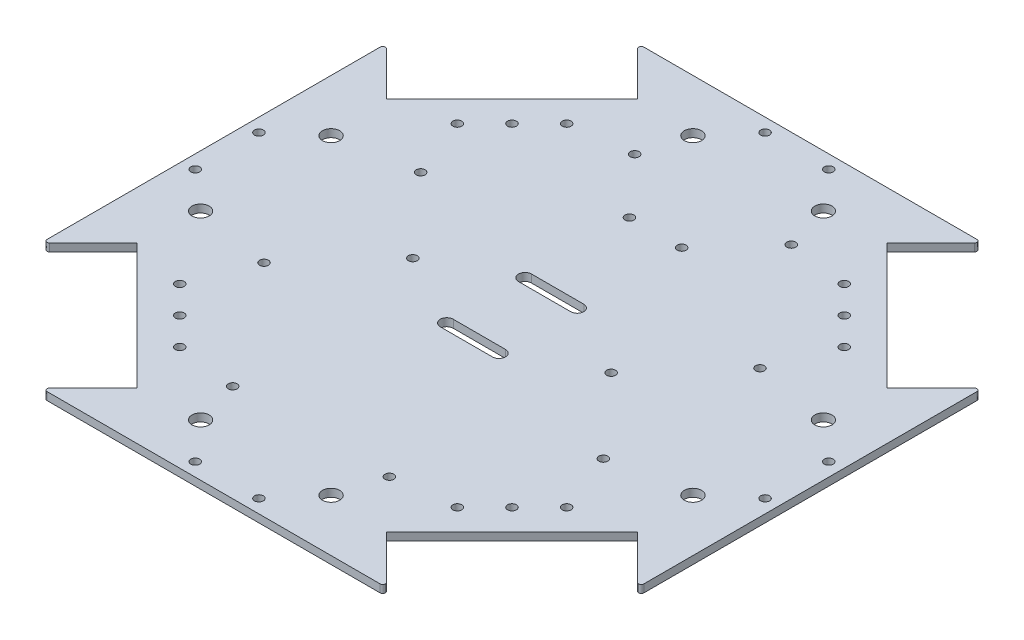
from build123d import *

# Parameters (mm, degrees)
SKETCH1_W                                   = 228.6
SKETCH1_H                                   = 228.6
PLATE_DEPTH                                 = 3
SKETCH8_R                                   = 1.7
MOTOR_MOUNT_HOLES_DEPTH                     = 3
SKETCH9_R                                   = 1.7
CONNECTOR_BOARD_HOLES_DEPTH                 = 3
MOTOR_CONTROLLER_HOLDER_ARDUINO_HOLES_REACH = 163.672
SKETCH11_R                                  = 1.7
CABLE_SLOTS_REACH                           = 163.672
WALL_BRACKET_HOLES_REACH                    = 163.672
SKETCH13_R                                  = 1.7
BATTERY_HOLDER_HOLES_REACH                  = 163.672
SKETCH14_R                                  = 1.7
LOAD_MOUNT_HOLES_REACH                      = 163.672
SKETCH15_R                                  = 3.3
LEVEL2_STANDOFF_HOLES_REACH                 = 163.672
SKETCH10_R                                  = 1.7
WHEEL_SLOTS_DEPTH                           = 3
FILLET1_R                                   = 1


with BuildPart() as part:
    # Sketch1 → plate (new body)
    with BuildSketch(Plane(origin=(0, 0, 0), x_dir=(1, 0, 0), z_dir=(0, 1, 0))):
        Rectangle(SKETCH1_W, SKETCH1_H)
    extrude(amount=PLATE_DEPTH)

    # Sketch8 → motor-mount-holes (cut)
    with BuildSketch(Plane(origin=(0, 3, 0), x_dir=(1, 0, 0), z_dir=(0, 1, 0))):
        with Locations((63.639610307, 63.639610307)):
            Circle(SKETCH8_R)
        with Locations((74.104790668, 53.174429945)):
            Circle(SKETCH8_R)
        with Locations((53.174429945, 74.104790668)):
            Circle(SKETCH8_R)
        with Locations((63.639610307, -63.639610307)):
            Circle(SKETCH8_R)
        with Locations((74.104790668, -53.174429945)):
            Circle(SKETCH8_R)
        with Locations((53.174429945, -74.104790668)):
            Circle(SKETCH8_R)
        with Locations((-63.639610307, -63.639610307)):
            Circle(SKETCH8_R)
        with Locations((-53.174429945, -74.104790668)):
            Circle(SKETCH8_R)
        with Locations((-74.104790668, -53.174429945)):
            Circle(SKETCH8_R)
        with Locations((-63.639610307, 63.639610307)):
            Circle(SKETCH8_R)
        with Locations((-74.104790668, 53.174429945)):
            Circle(SKETCH8_R)
        with Locations((-53.174429945, 74.104790668)):
            Circle(SKETCH8_R)
    extrude(amount=-MOTOR_MOUNT_HOLES_DEPTH, mode=Mode.SUBTRACT)

    # Sketch9 → connector-board-holes (cut)
    with BuildSketch(Plane(origin=(0, 3, 0), x_dir=(1, 0, 0), z_dir=(0, 1, 0))):
        with Locations((-38, 0)):
            Circle(SKETCH9_R)
        with Locations((38, 0)):
            Circle(SKETCH9_R)
    extrude(amount=-CONNECTOR_BOARD_HOLES_DEPTH, mode=Mode.SUBTRACT)

    # Sketch11 → motor-controller-holder-arduino-holes (cut, up to next)
    with BuildSketch(Plane(origin=(0, 3, 0), x_dir=(1, 0, 0), z_dir=(0, 1, 0)), mode=Mode.PRIVATE) as motor_controller_holder_arduino_holes_sk1:
        with Locations((-10, 55)):
            Circle(SKETCH11_R)
    motor_controller_holder_arduino_holes_tool1 = extrude(motor_controller_holder_arduino_holes_sk1.sketch, amount=-MOTOR_CONTROLLER_HOLDER_ARDUINO_HOLES_REACH, mode=Mode.PRIVATE) & part.part
    # Sketch11 → motor-controller-holder-arduino-holes (cut, up to next)
    with BuildSketch(Plane(origin=(0, 3, 0), x_dir=(1, 0, 0), z_dir=(0, 1, 0)), mode=Mode.PRIVATE) as motor_controller_holder_arduino_holes_sk2:
        with Locations((10, 55)):
            Circle(SKETCH11_R)
    motor_controller_holder_arduino_holes_tool2 = extrude(motor_controller_holder_arduino_holes_sk2.sketch, amount=-MOTOR_CONTROLLER_HOLDER_ARDUINO_HOLES_REACH, mode=Mode.PRIVATE) & part.part
    add(motor_controller_holder_arduino_holes_tool1.solids().sort_by_distance((-10, 3, -55))[0], mode=Mode.SUBTRACT)
    add(motor_controller_holder_arduino_holes_tool2.solids().sort_by_distance((10, 3, -55))[0], mode=Mode.SUBTRACT)

    # Sketch12 → cable-slots (cut, up to next)
    with BuildSketch(Plane(origin=(0, 3, 0), x_dir=(1, 0, 0), z_dir=(0, 1, 0)), mode=Mode.PRIVATE) as cable_slots_sk1:
        with BuildLine():
            Line((-10, 17.5), (10, 17.5))
            ThreePointArc((10, 17.5), (12.5, 15), (10, 12.5))
            Line((10, 12.5), (-10, 12.5))
            ThreePointArc((-10, 12.5), (-12.5, 15), (-10, 17.5))
        make_face()
    cable_slots_tool1 = extrude(cable_slots_sk1.sketch, amount=-CABLE_SLOTS_REACH, mode=Mode.PRIVATE) & part.part
    # Sketch12 → cable-slots (cut, up to next)
    with BuildSketch(Plane(origin=(0, 3, 0), x_dir=(1, 0, 0), z_dir=(0, 1, 0)), mode=Mode.PRIVATE) as cable_slots_sk2:
        with BuildLine():
            Line((-10, -12.5), (10, -12.5))
            ThreePointArc((10, -12.5), (12.5, -15), (10, -17.5))
            Line((10, -17.5), (-10, -17.5))
            ThreePointArc((-10, -17.5), (-12.5, -15), (-10, -12.5))
        make_face()
    cable_slots_tool2 = extrude(cable_slots_sk2.sketch, amount=-CABLE_SLOTS_REACH, mode=Mode.PRIVATE) & part.part
    add(cable_slots_tool1.solids().sort_by_distance((0, 3, -15))[0], mode=Mode.SUBTRACT)
    add(cable_slots_tool2.solids().sort_by_distance((0, 3, 15))[0], mode=Mode.SUBTRACT)

    # Sketch13 → wall-bracket-holes (cut, up to next)
    with BuildSketch(Plane(origin=(0, 3, 0), x_dir=(1, 0, 0), z_dir=(0, 1, 0)), mode=Mode.PRIVATE) as wall_bracket_holes_sk1:
        with Locations((-12.2, 109.1438)):
            Circle(SKETCH13_R)
    wall_bracket_holes_tool1 = extrude(wall_bracket_holes_sk1.sketch, amount=-WALL_BRACKET_HOLES_REACH, mode=Mode.PRIVATE) & part.part
    # Sketch13 → wall-bracket-holes (cut, up to next)
    with BuildSketch(Plane(origin=(0, 3, 0), x_dir=(1, 0, 0), z_dir=(0, 1, 0)), mode=Mode.PRIVATE) as wall_bracket_holes_sk2:
        with Locations((12.2, 109.1438)):
            Circle(SKETCH13_R)
    wall_bracket_holes_tool2 = extrude(wall_bracket_holes_sk2.sketch, amount=-WALL_BRACKET_HOLES_REACH, mode=Mode.PRIVATE) & part.part
    # Sketch13 → wall-bracket-holes (cut, up to next)
    with BuildSketch(Plane(origin=(0, 3, 0), x_dir=(1, 0, 0), z_dir=(0, 1, 0)), mode=Mode.PRIVATE) as wall_bracket_holes_sk3:
        with Locations((109.1438, -12.2)):
            Circle(SKETCH13_R)
    wall_bracket_holes_tool3 = extrude(wall_bracket_holes_sk3.sketch, amount=-WALL_BRACKET_HOLES_REACH, mode=Mode.PRIVATE) & part.part
    # Sketch13 → wall-bracket-holes (cut, up to next)
    with BuildSketch(Plane(origin=(0, 3, 0), x_dir=(1, 0, 0), z_dir=(0, 1, 0)), mode=Mode.PRIVATE) as wall_bracket_holes_sk4:
        with Locations((109.1438, 12.2)):
            Circle(SKETCH13_R)
    wall_bracket_holes_tool4 = extrude(wall_bracket_holes_sk4.sketch, amount=-WALL_BRACKET_HOLES_REACH, mode=Mode.PRIVATE) & part.part
    # Sketch13 → wall-bracket-holes (cut, up to next)
    with BuildSketch(Plane(origin=(0, 3, 0), x_dir=(1, 0, 0), z_dir=(0, 1, 0)), mode=Mode.PRIVATE) as wall_bracket_holes_sk5:
        with Locations((-12.2, -109.1438)):
            Circle(SKETCH13_R)
    wall_bracket_holes_tool5 = extrude(wall_bracket_holes_sk5.sketch, amount=-WALL_BRACKET_HOLES_REACH, mode=Mode.PRIVATE) & part.part
    # Sketch13 → wall-bracket-holes (cut, up to next)
    with BuildSketch(Plane(origin=(0, 3, 0), x_dir=(1, 0, 0), z_dir=(0, 1, 0)), mode=Mode.PRIVATE) as wall_bracket_holes_sk6:
        with Locations((12.2, -109.1438)):
            Circle(SKETCH13_R)
    wall_bracket_holes_tool6 = extrude(wall_bracket_holes_sk6.sketch, amount=-WALL_BRACKET_HOLES_REACH, mode=Mode.PRIVATE) & part.part
    # Sketch13 → wall-bracket-holes (cut, up to next)
    with BuildSketch(Plane(origin=(0, 3, 0), x_dir=(1, 0, 0), z_dir=(0, 1, 0)), mode=Mode.PRIVATE) as wall_bracket_holes_sk7:
        with Locations((-109.1438, 12.2)):
            Circle(SKETCH13_R)
    wall_bracket_holes_tool7 = extrude(wall_bracket_holes_sk7.sketch, amount=-WALL_BRACKET_HOLES_REACH, mode=Mode.PRIVATE) & part.part
    # Sketch13 → wall-bracket-holes (cut, up to next)
    with BuildSketch(Plane(origin=(0, 3, 0), x_dir=(1, 0, 0), z_dir=(0, 1, 0)), mode=Mode.PRIVATE) as wall_bracket_holes_sk8:
        with Locations((-109.1438, -12.2)):
            Circle(SKETCH13_R)
    wall_bracket_holes_tool8 = extrude(wall_bracket_holes_sk8.sketch, amount=-WALL_BRACKET_HOLES_REACH, mode=Mode.PRIVATE) & part.part
    add(wall_bracket_holes_tool1.solids().sort_by_distance((-12.2, 3, -109.1438))[0], mode=Mode.SUBTRACT)
    add(wall_bracket_holes_tool2.solids().sort_by_distance((12.2, 3, -109.1438))[0], mode=Mode.SUBTRACT)
    add(wall_bracket_holes_tool3.solids().sort_by_distance((109.1438, 3, 12.2))[0], mode=Mode.SUBTRACT)
    add(wall_bracket_holes_tool4.solids().sort_by_distance((109.1438, 3, -12.2))[0], mode=Mode.SUBTRACT)
    add(wall_bracket_holes_tool5.solids().sort_by_distance((-12.2, 3, 109.1438))[0], mode=Mode.SUBTRACT)
    add(wall_bracket_holes_tool6.solids().sort_by_distance((12.2, 3, 109.1438))[0], mode=Mode.SUBTRACT)
    add(wall_bracket_holes_tool7.solids().sort_by_distance((-109.1438, 3, -12.2))[0], mode=Mode.SUBTRACT)
    add(wall_bracket_holes_tool8.solids().sort_by_distance((-109.1438, 3, 12.2))[0], mode=Mode.SUBTRACT)

    # Sketch14 → battery-holder-holes (cut, up to next)
    with BuildSketch(Plane(origin=(0, 3, 0), x_dir=(1, 0, 0), z_dir=(0, 1, 0)), mode=Mode.PRIVATE) as battery_holder_holes_sk1:
        with Locations((-65, 30)):
            Circle(SKETCH14_R)
    battery_holder_holes_tool1 = extrude(battery_holder_holes_sk1.sketch, amount=-BATTERY_HOLDER_HOLES_REACH, mode=Mode.PRIVATE) & part.part
    # Sketch14 → battery-holder-holes (cut, up to next)
    with BuildSketch(Plane(origin=(0, 3, 0), x_dir=(1, 0, 0), z_dir=(0, 1, 0)), mode=Mode.PRIVATE) as battery_holder_holes_sk2:
        with Locations((-65, -30)):
            Circle(SKETCH14_R)
    battery_holder_holes_tool2 = extrude(battery_holder_holes_sk2.sketch, amount=-BATTERY_HOLDER_HOLES_REACH, mode=Mode.PRIVATE) & part.part
    # Sketch14 → battery-holder-holes (cut, up to next)
    with BuildSketch(Plane(origin=(0, 3, 0), x_dir=(1, 0, 0), z_dir=(0, 1, 0)), mode=Mode.PRIVATE) as battery_holder_holes_sk3:
        with Locations((65, -30)):
            Circle(SKETCH14_R)
    battery_holder_holes_tool3 = extrude(battery_holder_holes_sk3.sketch, amount=-BATTERY_HOLDER_HOLES_REACH, mode=Mode.PRIVATE) & part.part
    # Sketch14 → battery-holder-holes (cut, up to next)
    with BuildSketch(Plane(origin=(0, 3, 0), x_dir=(1, 0, 0), z_dir=(0, 1, 0)), mode=Mode.PRIVATE) as battery_holder_holes_sk4:
        with Locations((65, 30)):
            Circle(SKETCH14_R)
    battery_holder_holes_tool4 = extrude(battery_holder_holes_sk4.sketch, amount=-BATTERY_HOLDER_HOLES_REACH, mode=Mode.PRIVATE) & part.part
    add(battery_holder_holes_tool1.solids().sort_by_distance((-65, 3, -30))[0], mode=Mode.SUBTRACT)
    add(battery_holder_holes_tool2.solids().sort_by_distance((-65, 3, 30))[0], mode=Mode.SUBTRACT)
    add(battery_holder_holes_tool3.solids().sort_by_distance((65, 3, 30))[0], mode=Mode.SUBTRACT)
    add(battery_holder_holes_tool4.solids().sort_by_distance((65, 3, -30))[0], mode=Mode.SUBTRACT)

    # Sketch15 → load-mount-holes (cut, up to next)
    with BuildSketch(Plane(origin=(0, 3, 0), x_dir=(1, 0, 0), z_dir=(0, 1, 0)), mode=Mode.PRIVATE) as load_mount_holes_sk1:
        with Locations((-94.3, 25)):
            Circle(SKETCH15_R)
    load_mount_holes_tool1 = extrude(load_mount_holes_sk1.sketch, amount=-LOAD_MOUNT_HOLES_REACH, mode=Mode.PRIVATE) & part.part
    # Sketch15 → load-mount-holes (cut, up to next)
    with BuildSketch(Plane(origin=(0, 3, 0), x_dir=(1, 0, 0), z_dir=(0, 1, 0)), mode=Mode.PRIVATE) as load_mount_holes_sk2:
        with Locations((-94.3, -25)):
            Circle(SKETCH15_R)
    load_mount_holes_tool2 = extrude(load_mount_holes_sk2.sketch, amount=-LOAD_MOUNT_HOLES_REACH, mode=Mode.PRIVATE) & part.part
    # Sketch15 → load-mount-holes (cut, up to next)
    with BuildSketch(Plane(origin=(0, 3, 0), x_dir=(1, 0, 0), z_dir=(0, 1, 0)), mode=Mode.PRIVATE) as load_mount_holes_sk3:
        with Locations((94.3, 25)):
            Circle(SKETCH15_R)
    load_mount_holes_tool3 = extrude(load_mount_holes_sk3.sketch, amount=-LOAD_MOUNT_HOLES_REACH, mode=Mode.PRIVATE) & part.part
    # Sketch15 → load-mount-holes (cut, up to next)
    with BuildSketch(Plane(origin=(0, 3, 0), x_dir=(1, 0, 0), z_dir=(0, 1, 0)), mode=Mode.PRIVATE) as load_mount_holes_sk4:
        with Locations((94.3, -25)):
            Circle(SKETCH15_R)
    load_mount_holes_tool4 = extrude(load_mount_holes_sk4.sketch, amount=-LOAD_MOUNT_HOLES_REACH, mode=Mode.PRIVATE) & part.part
    # Sketch15 → load-mount-holes (cut, up to next)
    with BuildSketch(Plane(origin=(0, 3, 0), x_dir=(1, 0, 0), z_dir=(0, 1, 0)), mode=Mode.PRIVATE) as load_mount_holes_sk5:
        with Locations((25, 94.3)):
            Circle(SKETCH15_R)
    load_mount_holes_tool5 = extrude(load_mount_holes_sk5.sketch, amount=-LOAD_MOUNT_HOLES_REACH, mode=Mode.PRIVATE) & part.part
    # Sketch15 → load-mount-holes (cut, up to next)
    with BuildSketch(Plane(origin=(0, 3, 0), x_dir=(1, 0, 0), z_dir=(0, 1, 0)), mode=Mode.PRIVATE) as load_mount_holes_sk6:
        with Locations((-25, 94.3)):
            Circle(SKETCH15_R)
    load_mount_holes_tool6 = extrude(load_mount_holes_sk6.sketch, amount=-LOAD_MOUNT_HOLES_REACH, mode=Mode.PRIVATE) & part.part
    # Sketch15 → load-mount-holes (cut, up to next)
    with BuildSketch(Plane(origin=(0, 3, 0), x_dir=(1, 0, 0), z_dir=(0, 1, 0)), mode=Mode.PRIVATE) as load_mount_holes_sk7:
        with Locations((25, -94.3)):
            Circle(SKETCH15_R)
    load_mount_holes_tool7 = extrude(load_mount_holes_sk7.sketch, amount=-LOAD_MOUNT_HOLES_REACH, mode=Mode.PRIVATE) & part.part
    # Sketch15 → load-mount-holes (cut, up to next)
    with BuildSketch(Plane(origin=(0, 3, 0), x_dir=(1, 0, 0), z_dir=(0, 1, 0)), mode=Mode.PRIVATE) as load_mount_holes_sk8:
        with Locations((-25, -94.3)):
            Circle(SKETCH15_R)
    load_mount_holes_tool8 = extrude(load_mount_holes_sk8.sketch, amount=-LOAD_MOUNT_HOLES_REACH, mode=Mode.PRIVATE) & part.part
    add(load_mount_holes_tool1.solids().sort_by_distance((-94.3, 3, -25))[0], mode=Mode.SUBTRACT)
    add(load_mount_holes_tool2.solids().sort_by_distance((-94.3, 3, 25))[0], mode=Mode.SUBTRACT)
    add(load_mount_holes_tool3.solids().sort_by_distance((94.3, 3, -25))[0], mode=Mode.SUBTRACT)
    add(load_mount_holes_tool4.solids().sort_by_distance((94.3, 3, 25))[0], mode=Mode.SUBTRACT)
    add(load_mount_holes_tool5.solids().sort_by_distance((25, 3, -94.3))[0], mode=Mode.SUBTRACT)
    add(load_mount_holes_tool6.solids().sort_by_distance((-25, 3, -94.3))[0], mode=Mode.SUBTRACT)
    add(load_mount_holes_tool7.solids().sort_by_distance((25, 3, 94.3))[0], mode=Mode.SUBTRACT)
    add(load_mount_holes_tool8.solids().sort_by_distance((-25, 3, 94.3))[0], mode=Mode.SUBTRACT)

    # Sketch10 → level2-standoff-holes (cut, up to next)
    with BuildSketch(Plane(origin=(0, 3, 0), x_dir=(1, 0, 0), z_dir=(0, 1, 0)), mode=Mode.PRIVATE) as level2_standoff_holes_sk1:
        with Locations((30, 77)):
            Circle(SKETCH10_R)
    level2_standoff_holes_tool1 = extrude(level2_standoff_holes_sk1.sketch, amount=-LEVEL2_STANDOFF_HOLES_REACH, mode=Mode.PRIVATE) & part.part
    # Sketch10 → level2-standoff-holes (cut, up to next)
    with BuildSketch(Plane(origin=(0, 3, 0), x_dir=(1, 0, 0), z_dir=(0, 1, 0)), mode=Mode.PRIVATE) as level2_standoff_holes_sk2:
        with Locations((30, -77)):
            Circle(SKETCH10_R)
    level2_standoff_holes_tool2 = extrude(level2_standoff_holes_sk2.sketch, amount=-LEVEL2_STANDOFF_HOLES_REACH, mode=Mode.PRIVATE) & part.part
    # Sketch10 → level2-standoff-holes (cut, up to next)
    with BuildSketch(Plane(origin=(0, 3, 0), x_dir=(1, 0, 0), z_dir=(0, 1, 0)), mode=Mode.PRIVATE) as level2_standoff_holes_sk3:
        with Locations((-30, -77)):
            Circle(SKETCH10_R)
    level2_standoff_holes_tool3 = extrude(level2_standoff_holes_sk3.sketch, amount=-LEVEL2_STANDOFF_HOLES_REACH, mode=Mode.PRIVATE) & part.part
    # Sketch10 → level2-standoff-holes (cut, up to next)
    with BuildSketch(Plane(origin=(0, 3, 0), x_dir=(1, 0, 0), z_dir=(0, 1, 0)), mode=Mode.PRIVATE) as level2_standoff_holes_sk4:
        with Locations((-30, 77)):
            Circle(SKETCH10_R)
    level2_standoff_holes_tool4 = extrude(level2_standoff_holes_sk4.sketch, amount=-LEVEL2_STANDOFF_HOLES_REACH, mode=Mode.PRIVATE) & part.part
    add(level2_standoff_holes_tool1.solids().sort_by_distance((30, 3, -77))[0], mode=Mode.SUBTRACT)
    add(level2_standoff_holes_tool2.solids().sort_by_distance((30, 3, 77))[0], mode=Mode.SUBTRACT)
    add(level2_standoff_holes_tool3.solids().sort_by_distance((-30, 3, 77))[0], mode=Mode.SUBTRACT)
    add(level2_standoff_holes_tool4.solids().sort_by_distance((-30, 3, -77))[0], mode=Mode.SUBTRACT)

    # Sketch2 → wheel-slots (cut)
    with BuildSketch(Plane(origin=(0, 3, 0), x_dir=(1, 0, 0), z_dir=(0, 1, 0))):
        Polygon((114.3, 114.3), (66.216738879, 114.3), (47.800418408, 95.883679529), (95.883679529, 47.800418408), (114.3, 66.216738879), align=None)
        Polygon((66.216738879, -114.3), (114.3, -114.3), (114.3, -66.216738879), (95.883679529, -47.800418408), (47.800418408, -95.883679529), align=None)
        Polygon((-114.3, -66.216738879), (-114.3, -114.3), (-66.216738879, -114.3), (-47.800418408, -95.883679529), (-95.883679529, -47.800418408), align=None)
        Polygon((-66.216738879, 114.3), (-114.3, 114.3), (-114.3, 66.216738879), (-95.883679529, 47.800418408), (-47.800418408, 95.883679529), align=None)
    extrude(amount=-WHEEL_SLOTS_DEPTH, mode=Mode.SUBTRACT)

    # Fillet1
    fillet1_edges = [part.edges().sort_by_distance(p)[0] for p in [
        (66.216738879, 1.5, -114.3),
        (114.3, 1.5, -66.216738879),
        (114.3, 1.5, 66.216738879),
        (-66.216738879, 1.5, -114.3),
        (-114.3, 1.5, -66.216738879),
        (-114.3, 1.5, 66.216738879),
        (-66.216738879, 1.5, 114.3),
        (66.216738879, 1.5, 114.3),
    ]]
    fillet(fillet1_edges, radius=FILLET1_R)


solid = part.part
